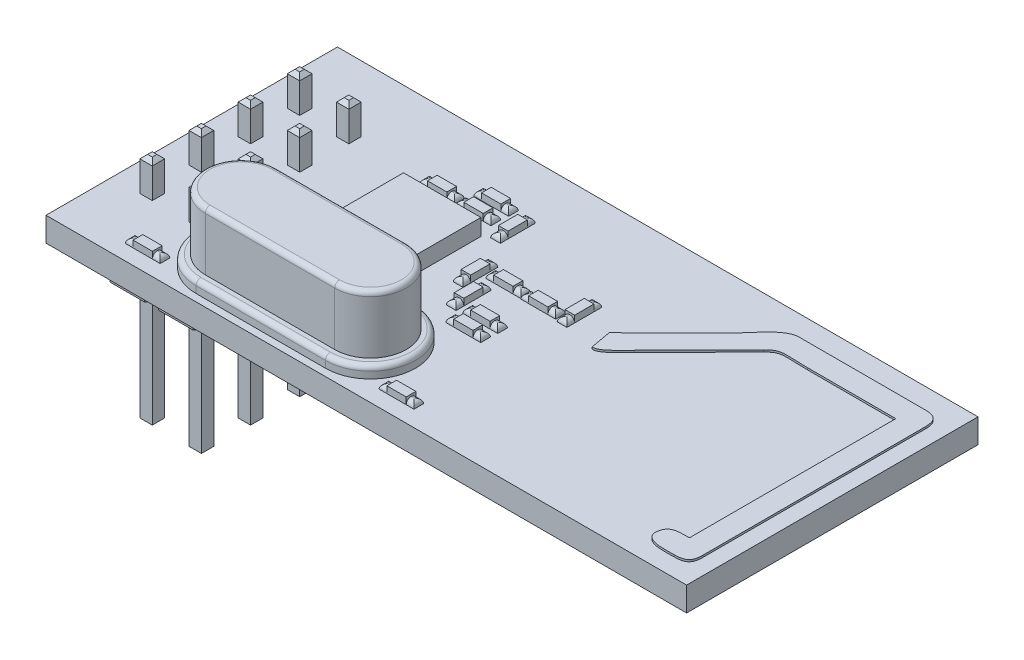
from build123d import *

# Parameters (mm, degrees)
SKETCH3_W                 = 33.1089
SKETCH3_H                 = 15.0622
BOSS_EXTRUDE1_DEPTH       = 1.25
SKETCH4_W                 = 1
SKETCH4_H                 = 0.5
SKETCH4_W_2               = 0.5
SKETCH4_H_2               = 1
BOSS_EXTRUDE2_DEPTH       = 0.35
SKETCH5_W                 = 0.4
SKETCH5_H                 = 0.5
SKETCH5_W_2               = 0.5
SKETCH5_H_2               = 0.4
BOSS_EXTRUDE4_DEPTH       = 0.25
FILLET3_R                 = 0.25
SKETCH6_W                 = 4
SKETCH6_H                 = 4
BOSS_EXTRUDE5_DEPTH       = 0.85
BOSS_EXTRUDE6_DEPTH       = 0.6
BOSS_EXTRUDE7_DEPTH       = 3
FILLET4_R                 = 0.25
BOSS_EXTRUDE10_DEPTH      = 3.79
LPATTERN1_COUNT           = 4
LPATTERN1_PITCH           = 2.54
BOSS_EXTRUDE12_DEPTH      = 1.35
BOSS_EXTRUDE13_DEPTH      = 6.46
BOSS_EXTRUDE13_DEPTH_BACK = 5.54
SKETCH12_W                = 0.64
SKETCH12_H                = 0.64
CHAMFER1_SIZE             = 0.2


with BuildPart() as part:
    # Sketch3 → Boss-Extrude1 (new body)
    with BuildSketch(Plane(origin=(0, 0, 0), x_dir=(1, 0, 0), z_dir=(0, 1, 0))):
        with Locations((-83.435615783, -76.453529525)):
            Rectangle(SKETCH3_W, SKETCH3_H)
    extrude(amount=BOSS_EXTRUDE1_DEPTH)

    # Sketch4 → Boss-Extrude2 (add)
    with BuildSketch(Plane(origin=(0, 1.25, 0), x_dir=(1, 0, 0), z_dir=(0, 1, 0))):
        with Locations((-95.776830998, -82.947374306)):
            Rectangle(SKETCH4_W, SKETCH4_H)
        with Locations((-82.698373289, -82.909037458)):
            Rectangle(SKETCH4_W, SKETCH4_H)
        with Locations((-88.60490262, -78.339420972)):
            Rectangle(SKETCH4_W, SKETCH4_H)
        with Locations((-83.952669292, -78.202381405)):
            Rectangle(SKETCH4_W, SKETCH4_H)
        with Locations((-83.921675536, -77.354680713)):
            Rectangle(SKETCH4_W, SKETCH4_H)
        with Locations((-84.889862517, -75.193516265)):
            Rectangle(SKETCH4_W, SKETCH4_H)
        with Locations((-83.065172821, -75.21800007)):
            Rectangle(SKETCH4_W, SKETCH4_H)
        with Locations((-88.921842397, -72.706001666)):
            Rectangle(SKETCH4_W, SKETCH4_H)
        with Locations((-88.887318726, -71.826952056)):
            Rectangle(SKETCH4_W, SKETCH4_H)
        with Locations((-90.823135038, -72.683630839)):
            Rectangle(SKETCH4_W, SKETCH4_H)
        with Locations((-85.376206874, -76.751980727)):
            Rectangle(SKETCH4_W_2, SKETCH4_H_2)
        with Locations((-86.237532743, -75.536214652)):
            Rectangle(SKETCH4_W_2, SKETCH4_H_2)
        with Locations((-81.75613614, -74.645763333)):
            Rectangle(SKETCH4_W_2, SKETCH4_H_2)
        with Locations((-87.239742915, -72.600873536)):
            Rectangle(SKETCH4_W_2, SKETCH4_H_2)
    extrude(amount=BOSS_EXTRUDE2_DEPTH)

    # Sketch5 → Boss-Extrude4 (add)
    with BuildSketch(Plane(origin=(0, 1.25, 0), x_dir=(1, 0, 0), z_dir=(0, 1, 0))):
        with Locations((-81.998373289, -82.909037458)):
            Rectangle(SKETCH5_W, SKETCH5_H)
        with Locations((-83.398373289, -82.909037458)):
            Rectangle(SKETCH5_W, SKETCH5_H)
        with Locations((-84.189862517, -75.193516265)):
            Rectangle(SKETCH5_W, SKETCH5_H)
        with Locations((-85.589862517, -75.193516265)):
            Rectangle(SKETCH5_W, SKETCH5_H)
        with Locations((-82.365172821, -75.21800007)):
            Rectangle(SKETCH5_W, SKETCH5_H)
        with Locations((-83.765172821, -75.21800007)):
            Rectangle(SKETCH5_W, SKETCH5_H)
        with Locations((-90.123135038, -72.683630839)):
            Rectangle(SKETCH5_W, SKETCH5_H)
        with Locations((-91.523135038, -72.683630839)):
            Rectangle(SKETCH5_W, SKETCH5_H)
        with Locations((-88.221842397, -72.706001666)):
            Rectangle(SKETCH5_W, SKETCH5_H)
        with Locations((-89.621842397, -72.706001666)):
            Rectangle(SKETCH5_W, SKETCH5_H)
        with Locations((-88.187318726, -71.826952056)):
            Rectangle(SKETCH5_W, SKETCH5_H)
        with Locations((-89.587318726, -71.826952056)):
            Rectangle(SKETCH5_W, SKETCH5_H)
        with Locations((-87.239742915, -71.900873536)):
            Rectangle(SKETCH5_W_2, SKETCH5_H_2)
        with Locations((-87.239742915, -73.300873536)):
            Rectangle(SKETCH5_W_2, SKETCH5_H_2)
        with Locations((-87.90490262, -78.339420972)):
            Rectangle(SKETCH5_W, SKETCH5_H)
        with Locations((-89.30490262, -78.339420972)):
            Rectangle(SKETCH5_W, SKETCH5_H)
        with Locations((-83.221675536, -77.354680713)):
            Rectangle(SKETCH5_W, SKETCH5_H)
        with Locations((-84.621675536, -77.354680713)):
            Rectangle(SKETCH5_W, SKETCH5_H)
        with Locations((-83.252669292, -78.202381405)):
            Rectangle(SKETCH5_W, SKETCH5_H)
        with Locations((-84.652669292, -78.202381405)):
            Rectangle(SKETCH5_W, SKETCH5_H)
        with Locations((-81.75613614, -73.945763333)):
            Rectangle(SKETCH5_W_2, SKETCH5_H_2)
        with Locations((-81.75613614, -75.345763333)):
            Rectangle(SKETCH5_W_2, SKETCH5_H_2)
        with Locations((-85.376206874, -77.451980727)):
            Rectangle(SKETCH5_W_2, SKETCH5_H_2)
        with Locations((-85.376206874, -76.051980727)):
            Rectangle(SKETCH5_W_2, SKETCH5_H_2)
        with Locations((-86.237532743, -76.236214652)):
            Rectangle(SKETCH5_W_2, SKETCH5_H_2)
        with Locations((-86.237532743, -74.836214652)):
            Rectangle(SKETCH5_W_2, SKETCH5_H_2)
        with Locations((-96.476830998, -82.947374306)):
            Rectangle(SKETCH5_W, SKETCH5_H)
        with Locations((-95.076830998, -82.947374306)):
            Rectangle(SKETCH5_W, SKETCH5_H)
    extrude(amount=BOSS_EXTRUDE4_DEPTH)

    # Fillet3
    fillet3_edges = [part.edges().sort_by_distance(p)[0] for p in [
        (-94.876830998, 1.5, 82.947374306),
        (-95.076830998, 1.5, 82.697374306),
        (-95.076830998, 1.5, 83.197374306),
        (-91.523135038, 1.5, 72.433630839),
        (-91.723135038, 1.5, 72.683630839),
        (-91.523135038, 1.5, 72.933630839),
        (-89.923135038, 1.5, 72.683630839),
        (-90.123135038, 1.5, 72.433630839),
        (-90.123135038, 1.5, 72.933630839),
        (-89.587318726, 1.5, 71.576952056),
        (-89.787318726, 1.5, 71.826952056),
        (-89.587318726, 1.5, 72.076952056),
        (-89.621842397, 1.5, 72.456001666),
        (-89.821842397, 1.5, 72.706001666),
        (-89.621842397, 1.5, 72.956001666),
        (-88.187318726, 1.5, 71.576952056),
        (-87.987318726, 1.5, 71.826952056),
        (-88.187318726, 1.5, 72.076952056),
        (-88.221842397, 1.5, 72.456001666),
        (-88.021842397, 1.5, 72.706001666),
        (-88.221842397, 1.5, 72.956001666),
        (-86.989742915, 1.5, 71.900873536),
        (-87.239742915, 1.5, 71.700873536),
        (-87.489742915, 1.5, 71.900873536),
        (-86.989742915, 1.5, 73.300873536),
        (-87.239742915, 1.5, 73.500873536),
        (-87.489742915, 1.5, 73.300873536),
        (-81.50613614, 1.5, 73.945763333),
        (-81.75613614, 1.5, 73.745763333),
        (-82.00613614, 1.5, 73.945763333),
        (-81.50613614, 1.5, 75.345763333),
        (-81.75613614, 1.5, 75.545763333),
        (-82.00613614, 1.5, 75.345763333),
        (-82.365172821, 1.5, 74.96800007),
        (-82.165172821, 1.5, 75.21800007),
        (-82.365172821, 1.5, 75.46800007),
        (-83.765172821, 1.5, 75.46800007),
        (-83.965172821, 1.5, 75.21800007),
        (-83.765172821, 1.5, 74.96800007),
        (-84.189862517, 1.5, 74.943516265),
        (-83.989862517, 1.5, 75.193516265),
        (-84.189862517, 1.5, 75.443516265),
        (-85.589862517, 1.5, 74.943516265),
        (-85.589862517, 1.5, 75.443516265),
        (-85.789862517, 1.5, 75.193516265),
        (-85.987532743, 1.5, 74.836214652),
        (-86.237532743, 1.5, 74.636214652),
        (-86.487532743, 1.5, 74.836214652),
        (-85.987532743, 1.5, 76.236214652),
        (-86.237532743, 1.5, 76.436214652),
        (-86.487532743, 1.5, 76.236214652),
        (-85.126206874, 1.5, 76.051980727),
        (-85.376206874, 1.5, 75.851980727),
        (-85.626206874, 1.5, 76.051980727),
        (-83.221675536, 1.5, 77.104680713),
        (-83.021675536, 1.5, 77.354680713),
        (-83.221675536, 1.5, 77.604680713),
        (-83.252669292, 1.5, 77.952381405),
        (-83.052669292, 1.5, 78.202381405),
        (-83.252669292, 1.5, 78.452381405),
        (-85.626206874, 1.5, 77.451980727),
        (-85.126206874, 1.5, 77.451980727),
        (-85.376206874, 1.5, 77.651980727),
        (-84.621675536, 1.5, 77.104680713),
        (-84.621675536, 1.5, 77.604680713),
        (-84.821675536, 1.5, 77.354680713),
        (-84.652669292, 1.5, 77.952381405),
        (-84.652669292, 1.5, 78.452381405),
        (-84.852669292, 1.5, 78.202381405),
        (-87.90490262, 1.5, 78.089420972),
        (-87.70490262, 1.5, 78.339420972),
        (-87.90490262, 1.5, 78.589420972),
        (-89.30490262, 1.5, 78.089420972),
        (-89.50490262, 1.5, 78.339420972),
        (-89.30490262, 1.5, 78.589420972),
        (-81.998373289, 1.5, 82.659037458),
        (-81.798373289, 1.5, 82.909037458),
        (-81.998373289, 1.5, 83.159037458),
        (-83.398373289, 1.5, 82.659037458),
        (-83.598373289, 1.5, 82.909037458),
        (-83.398373289, 1.5, 83.159037458),
        (-96.676830998, 1.5, 82.947374306),
        (-96.476830998, 1.5, 82.697374306),
        (-96.476830998, 1.5, 83.197374306),
    ]]
    fillet(fillet3_edges, radius=FILLET3_R - 0.0001)  # a hair under: the kernel refuses the full size

    # Sketch6 → Boss-Extrude5 (add)
    with BuildSketch(Plane(origin=(0, 1.25, 0), x_dir=(1, 0, 0), z_dir=(0, 1, 0))):
        with Locations((-89.801723571, -75.694489541)):
            Rectangle(SKETCH6_W, SKETCH6_H)
    extrude(amount=BOSS_EXTRUDE5_DEPTH)

    # Sketch7 → Boss-Extrude6 (add)
    with BuildSketch(Plane(origin=(0, 1.25, 0), x_dir=(1, 0, 0), z_dir=(0, 1, 0))):
        with BuildLine():
            Line((-92.605248557, -78.961141299), (-85.915248557, -78.961141299))
            ThreePointArc((-85.915248557, -78.961141299), (-83.590248557, -81.286141299), (-85.915248557, -83.611141299))
            Line((-85.915248557, -83.611141299), (-92.605248557, -83.611141299))
            ThreePointArc((-92.605248557, -83.611141299), (-94.930248557, -81.286141299), (-92.605248557, -78.961141299))
        make_face()
    extrude(amount=BOSS_EXTRUDE6_DEPTH)

    # Sketch8 → Boss-Extrude7 (add)
    with BuildSketch(Plane(origin=(0, 1.85, 0), x_dir=(1, 0, 0), z_dir=(0, 1, 0))):
        with BuildLine():
            Line((-92.605248557, -79.436141299), (-85.915248557, -79.436141299))
            ThreePointArc((-85.915248557, -79.436141299), (-84.065248557, -81.286141299), (-85.915248557, -83.136141299))
            Line((-85.915248557, -83.136141299), (-92.605248557, -83.136141299))
            ThreePointArc((-92.605248557, -83.136141299), (-94.455248557, -81.286141299), (-92.605248557, -79.436141299))
        make_face()
    extrude(amount=BOSS_EXTRUDE7_DEPTH)

    # Fillet4
    fillet4_edges = [part.edges().sort_by_distance(p)[0] for p in [
        (-94.930248557, 1.85, 81.286141299),
        (-89.260248557, 1.85, 83.611141299),
        (-83.590248557, 1.85, 81.286141299),
        (-89.260248557, 1.85, 78.961141299),
        (-94.455248557, 4.85, 81.286141299),
        (-89.260248557, 4.85, 83.136141299),
        (-84.065248557, 4.85, 81.286141299),
        (-89.260248557, 4.85, 79.436141299),
    ]]
    fillet(fillet4_edges, radius=FILLET4_R)

    # Sketch9 → Boss-Extrude10 (add)
    with BuildSketch(Plane(origin=(0, 1.25, 0), x_dir=(1, 0, 0), z_dir=(0, 1, 0))):
        Polygon((-97.342717547, -73.913429525), (-96.989164156, -73.559876134), (-96.635610766, -73.913429525), (-94.842717547, -73.913429525), (-94.489164156, -73.559876134), (-94.489164156, -71.725982915), (-94.842717547, -71.372429525), (-96.635610766, -71.372429525), (-96.989164156, -71.725982915), (-97.342717547, -71.372429525), (-99.135610766, -71.372429525), (-99.489164156, -71.725982915), (-99.489164156, -73.559876134), (-99.135610766, -73.913429525), align=None)
    boss_extrude10 = extrude(amount=-BOSS_EXTRUDE10_DEPTH)

    # LPattern1: Boss-Extrude10 ×4
    with Locations(*[(0, 0, i * LPATTERN1_PITCH) for i in range(1, LPATTERN1_COUNT)]):
        add(boss_extrude10)

    # Sketch11 → Boss-Extrude12 (add)
    with BuildSketch(Plane(origin=(0, 0, 0), x_dir=(1, 0, 0), z_dir=(0, 1, 0))):
        with BuildLine():
            Line((-80.078519352, -74.781829208), (-79.882731972, -75.865199225))
            add(Edge.make_bspline(
                [(-79.882731972, -75.865199225), (-79.478934912, -75.908586736), (-78.911207514, -75.156734204), (-78.638874284, -74.919618324)],
                knots=[0.19047619, 0.19047619, 0.19047619, 0.19047619, 0.238095238, 0.238095238, 0.238095238, 0.238095238], degree=3))
            Line((-78.638874284, -74.919618324), (-75.317407096, -71.564762189))
            add(Edge.make_bspline(
                [(-75.317407096, -71.564762189), (-74.837228909, -71.061061843), (-74.653515578, -71.227397109), (-73.377141965, -71.227397109)],
                knots=[0.285714286, 0.285714286, 0.285714286, 0.285714286, 0.333333333, 0.333333333, 0.333333333, 0.333333333], degree=3))
            add(Edge.make_bspline(
                [(-73.377141965, -71.227397109), (-71.859386199, -71.227397109), (-70.341613961, -71.227397109), (-68.823874667, -71.227397109)],
                knots=[0.333333333, 0.333333333, 0.333333333, 0.333333333, 0.380952381, 0.380952381, 0.380952381, 0.380952381], degree=3))
            Line((-68.823874667, -71.227397109), (-68.823874667, -81.894251378))
            add(Edge.make_bspline(
                [(-68.823874667, -81.894251378), (-69.333735578, -81.894251378), (-69.773590064, -81.864963984), (-69.907063491, -82.284640148)],
                knots=[0.428571429, 0.428571429, 0.428571429, 0.428571429, 0.476190476, 0.476190476, 0.476190476, 0.476190476], degree=3))
            add(Edge.make_bspline(
                [(-69.907063491, -82.284640148), (-70.19226143, -83.181529521), (-68.953361845, -83.045404087), (-68.46559002, -83.045404087)],
                knots=[0.476190476, 0.476190476, 0.476190476, 0.476190476, 0.523809524, 0.523809524, 0.523809524, 0.523809524], degree=3))
            add(Edge.make_bspline(
                [(-68.46559002, -83.045404087), (-67.909689589, -83.045404087), (-67.698154881, -82.876845087), (-67.698154881, -82.329279539)],
                knots=[0.523809524, 0.523809524, 0.523809524, 0.523809524, 0.571428571, 0.571428571, 0.571428571, 0.571428571], degree=3))
            Line((-67.698154881, -82.329279539), (-67.698154881, -70.817834815))
            add(Edge.make_bspline(
                [(-67.698154881, -70.817834815), (-67.698154881, -70.271521146), (-67.931235096, -70.07584907), (-68.46559002, -70.07584907)],
                knots=[0.619047619, 0.619047619, 0.619047619, 0.619047619, 0.666666667, 0.666666667, 0.666666667, 0.666666667], degree=3))
            Line((-68.46559002, -70.07584907), (-74.988739285, -70.07584907))
            add(Edge.make_bspline(
                [(-74.988739285, -70.07584907), (-75.65182367, -70.07584907), (-76.305881345, -71.015516487), (-76.657774817, -71.374509434)],
                knots=[0.714285714, 0.714285714, 0.714285714, 0.714285714, 0.761904762, 0.761904762, 0.761904762, 0.761904762], degree=3))
            Line((-76.657774817, -71.374509434), (-79.68936599, -74.405606444))
            add(Edge.make_bspline(
                [(-79.68936599, -74.405606444), (-79.836692452, -74.553328236), (-79.926152427, -74.629808197), (-80.078519352, -74.781829208)],
                knots=[0.80952381, 0.80952381, 0.80952381, 0.80952381, 0.857142857, 0.857142857, 0.857142857, 0.857142857], degree=3))
        make_face()
    extrude(amount=BOSS_EXTRUDE12_DEPTH)

    # Sketch12 → Boss-Extrude13 (add, two sides: drawn at the far end of the back side and taken through both)
    with BuildSketch(Plane.XZ.offset(2.54).offset(-BOSS_EXTRUDE13_DEPTH_BACK)):
        with Locations((-98.219164156, 80.263429525)):
            Rectangle(SKETCH12_W, SKETCH12_H)
        with Locations((-95.679164156, 80.263429525)):
            Rectangle(SKETCH12_W, SKETCH12_H)
        with Locations((-95.679164156, 77.723429525)):
            Rectangle(SKETCH12_W, SKETCH12_H)
        with Locations((-95.679164156, 75.183429525)):
            Rectangle(SKETCH12_W, SKETCH12_H)
        with Locations((-95.679164156, 72.643429525)):
            Rectangle(SKETCH12_W, SKETCH12_H)
        with Locations((-98.219164156, 77.723429525)):
            Rectangle(SKETCH12_W, SKETCH12_H)
        with Locations((-98.219164156, 75.183429525)):
            Rectangle(SKETCH12_W, SKETCH12_H)
        with Locations((-98.219164156, 72.643429525)):
            Rectangle(SKETCH12_W, SKETCH12_H)
    extrude(amount=BOSS_EXTRUDE13_DEPTH + BOSS_EXTRUDE13_DEPTH_BACK)

    # Chamfer1
    chamfer1_edges = [part.edges().sort_by_distance(p)[0] for p in [
        (-98.539164156, 3, 80.263429525),
        (-98.219164156, 3, 79.943429525),
        (-97.899164156, 3, 80.263429525),
        (-98.219164156, 3, 80.583429525),
        (-98.539164156, -9, 80.263429525),
        (-98.219164156, -9, 79.943429525),
        (-97.899164156, -9, 80.263429525),
        (-98.219164156, -9, 80.583429525),
        (-95.999164156, 3, 80.263429525),
        (-95.679164156, 3, 79.943429525),
        (-95.359164156, 3, 80.263429525),
        (-95.679164156, 3, 80.583429525),
        (-95.999164156, -9, 80.263429525),
        (-95.679164156, -9, 79.943429525),
        (-95.359164156, -9, 80.263429525),
        (-95.679164156, -9, 80.583429525),
        (-95.999164156, 3, 77.723429525),
        (-95.679164156, 3, 77.403429525),
        (-95.359164156, 3, 77.723429525),
        (-95.679164156, 3, 78.043429525),
        (-95.999164156, -9, 77.723429525),
        (-95.679164156, -9, 77.403429525),
        (-95.359164156, -9, 77.723429525),
        (-95.679164156, -9, 78.043429525),
        (-95.999164156, 3, 75.183429525),
        (-95.679164156, 3, 74.863429525),
        (-95.359164156, 3, 75.183429525),
        (-95.679164156, 3, 75.503429525),
        (-95.999164156, -9, 75.183429525),
        (-95.679164156, -9, 74.863429525),
        (-95.359164156, -9, 75.183429525),
        (-95.679164156, -9, 75.503429525),
        (-95.999164156, 3, 72.643429525),
        (-95.679164156, 3, 72.323429525),
        (-95.359164156, 3, 72.643429525),
        (-95.679164156, 3, 72.963429525),
        (-95.999164156, -9, 72.643429525),
        (-95.679164156, -9, 72.323429525),
        (-95.359164156, -9, 72.643429525),
        (-95.679164156, -9, 72.963429525),
        (-98.539164156, 3, 77.723429525),
        (-98.219164156, 3, 77.403429525),
        (-97.899164156, 3, 77.723429525),
        (-98.219164156, 3, 78.043429525),
        (-98.539164156, -9, 77.723429525),
        (-98.219164156, -9, 77.403429525),
        (-97.899164156, -9, 77.723429525),
        (-98.219164156, -9, 78.043429525),
        (-98.539164156, 3, 75.183429525),
        (-98.219164156, 3, 74.863429525),
        (-97.899164156, 3, 75.183429525),
        (-98.219164156, 3, 75.503429525),
        (-98.539164156, -9, 75.183429525),
        (-98.219164156, -9, 74.863429525),
        (-97.899164156, -9, 75.183429525),
        (-98.219164156, -9, 75.503429525),
        (-98.539164156, 3, 72.643429525),
        (-98.219164156, 3, 72.323429525),
        (-97.899164156, 3, 72.643429525),
        (-98.219164156, 3, 72.963429525),
        (-98.539164156, -9, 72.643429525),
        (-98.219164156, -9, 72.323429525),
        (-97.899164156, -9, 72.643429525),
        (-98.219164156, -9, 72.963429525),
    ]]
    chamfer(chamfer1_edges, length=CHAMFER1_SIZE)


solid = part.part
